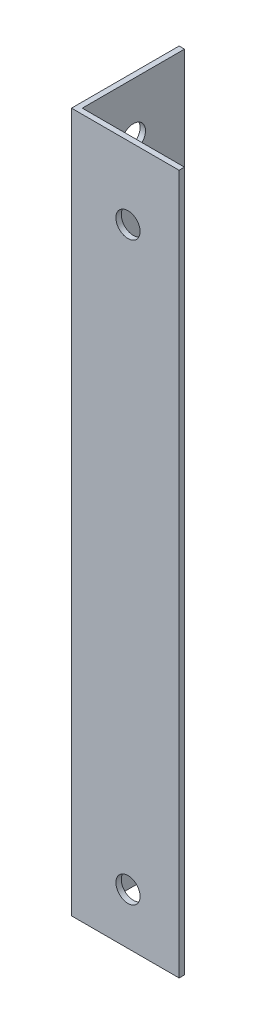
from build123d import *

# Parameters (mm, degrees)
EXTRUDE_1_DEPTH     = 130
SKETCH_2_R          = 2.25
CUT_EXTRUDE_1_DEPTH = 133.894695154
SKETCH_3_R          = 2.25
CUT_EXTRUDE_2_DEPTH = 133.894695154
SKETCH_4_R          = 2.25
CUT_EXTRUDE_3_DEPTH = 133.894695154
SKETCH_5_R          = 2.25
CUT_EXTRUDE_4_DEPTH = 133.894695154


with BuildPart() as part:
    # Эскиз1 → Бобышка-Вытянуть1 (new body)
    with BuildSketch(Plane(origin=(0, 0, 0), x_dir=(1, 0, 0), z_dir=(0, 1, 0))):
        Polygon((0, 0), (0, 20), (1, 20), (1, 1), (20, 1), (20, 0), align=None)
    extrude(amount=EXTRUDE_1_DEPTH)

    # Эскиз2 → Вырез-Вытянуть1 (cut, through all)
    with BuildSketch(Plane(origin=(0, 0, -1), x_dir=(-1, 0, 0), z_dir=(0, 0, -1))):
        with Locations((-10.5, 9.5)):
            Circle(SKETCH_2_R)
    extrude(amount=-CUT_EXTRUDE_1_DEPTH, mode=Mode.SUBTRACT)

    # Эскиз3 → Вырез-Вытянуть2 (cut, through all)
    with BuildSketch(Plane(origin=(0, 0, -1), x_dir=(-1, 0, 0), z_dir=(0, 0, -1))):
        with Locations((-10.5, 116.5)):
            Circle(SKETCH_3_R)
    extrude(amount=-CUT_EXTRUDE_2_DEPTH, mode=Mode.SUBTRACT)

    # Эскиз4 → Вырез-Вытянуть3 (cut, through all)
    with BuildSketch(Plane(origin=(1, 0, 0), x_dir=(0, 0, -1), z_dir=(1, 0, 0))):
        with Locations((10.5, 120.5)):
            Circle(SKETCH_4_R)
    extrude(amount=-CUT_EXTRUDE_3_DEPTH, mode=Mode.SUBTRACT)

    # Эскиз5 → Вырез-Вытянуть4 (cut, through all)
    with BuildSketch(Plane(origin=(1, 0, 0), x_dir=(0, 0, -1), z_dir=(1, 0, 0))):
        with Locations((10.5, 9.5)):
            Circle(SKETCH_5_R)
    extrude(amount=-CUT_EXTRUDE_4_DEPTH, mode=Mode.SUBTRACT)


solid = part.part
